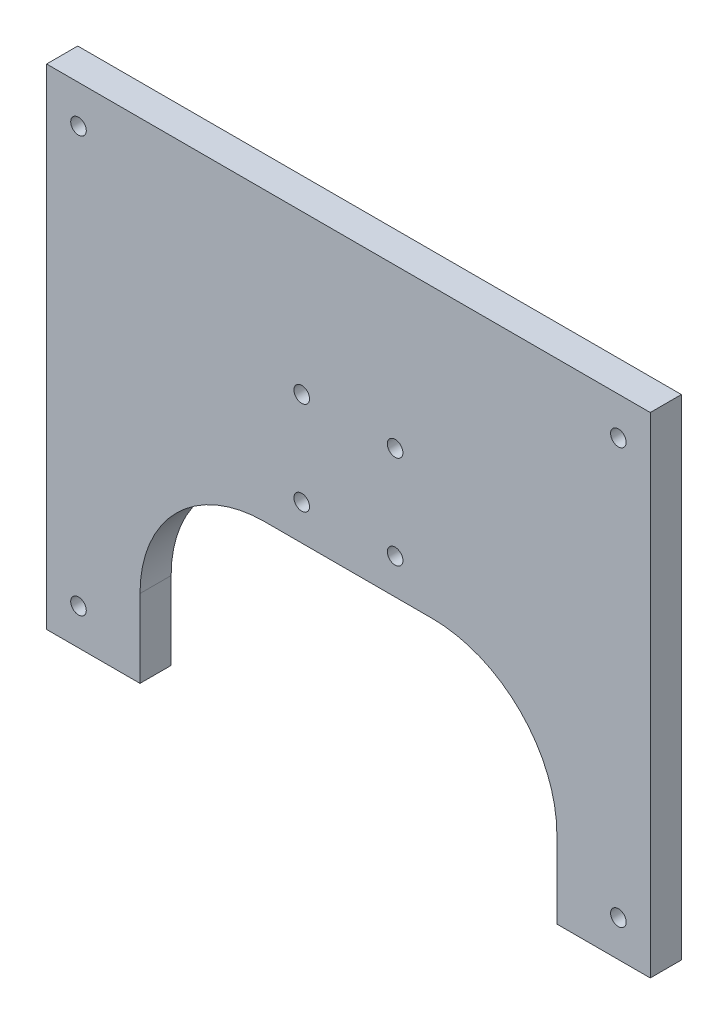
from build123d import *

# Parameters (mm, degrees)
BOSS_EXTRUDE1_DEPTH         = 12.7
F_1_4_0_25_DIAMETER_HOLE1_D = 6.35
FILLET2_R                   = 50.8


with BuildPart() as part:
    # Sketch1 → Boss-Extrude1 (new body)
    with BuildSketch(Plane.XY):
        Polygon((258.933482757, 10.713854335), (12.7, 10.713854335), (12.7, -189.051843155), (50.8, -189.051843155), (50.8, -106.501843155), (220.833482757, -106.501843155), (220.833482757, -189.051843155), (258.933482757, -189.051843155), align=None)
    extrude(amount=-BOSS_EXTRUDE1_DEPTH)

    # 1/4 (0.25) Diameter Hole1 (through all)
    with Locations(Plane(origin=(0, 0, -12.7), x_dir=(-1, 0, 0), z_dir=(0, 0, -1))):
        with Locations((-25.706162889, -174.233423282), (-116.766741379, -92.064314729), (-154.866741379, -92.064314729), (-245.927319868, -174.233423282), (-154.866741379, -53.964314729), (-245.927319868, -4.747970506), (-116.766741379, -53.964314729), (-25.706162889, -4.747970506)):
            Hole(F_1_4_0_25_DIAMETER_HOLE1_D / 2)

    # Fillet2
    fillet2_edges = [part.edges().sort_by_distance(p)[0] for p in [
        (220.833482757, -106.501843155, -6.35),
        (50.8, -106.501843155, -6.35),
    ]]
    fillet(fillet2_edges, radius=FILLET2_R)


solid = part.part
